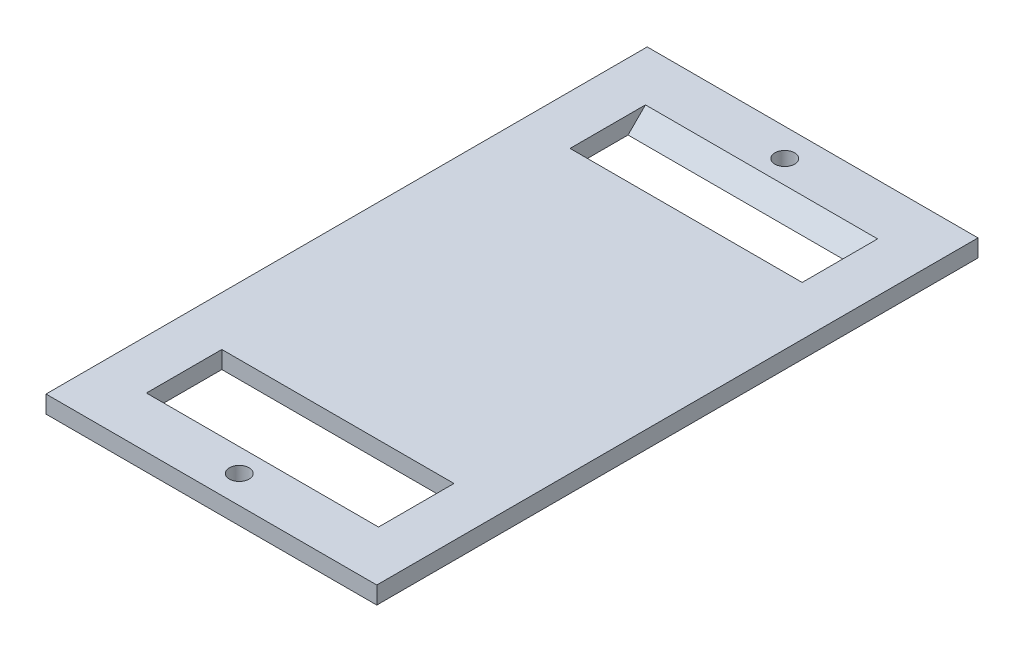
from build123d import *

# Parameters (mm, degrees)
SKETCH_1_W          = 57
SKETCH_1_H          = 103.6
SKETCH_1_R          = 1.7
EXTRUDE_1_DEPTH     = 3
SKETCH_2_W          = 40
SKETCH_2_H          = 10
CUT_EXTRUDE_1_DEPTH = 3
CHAMFER_1_SIZE      = 3


with BuildPart() as part:
    # 草图1 → 凸台-拉伸1 (new body)
    with BuildSketch(Plane(origin=(0, 0, 0), x_dir=(1, 0, 0), z_dir=(0, 1, 0))):
        Rectangle(SKETCH_1_W, SKETCH_1_H)
        with Locations(Location((0, 47, 0), (0, 0, 270))):
            Circle(SKETCH_1_R, mode=Mode.SUBTRACT)
        with Locations(Location((0, -47, 0), (0, 0, 270))):
            Circle(SKETCH_1_R, mode=Mode.SUBTRACT)
    extrude(amount=EXTRUDE_1_DEPTH)

    # 草图2 → 切除-拉伸1 (cut)
    with BuildSketch(Plane(origin=(0, 3, 0), x_dir=(1, 0, 0), z_dir=(0, 1, 0))):
        with Locations((0, 35)):
            Rectangle(SKETCH_2_W, SKETCH_2_H)
        with Locations((0, -35)):
            Rectangle(SKETCH_2_W, SKETCH_2_H)
    extrude(amount=-CUT_EXTRUDE_1_DEPTH, mode=Mode.SUBTRACT)

    # 倒角1
    chamfer_1_edges = [part.edges().sort_by_distance(p)[0] for p in [
        (0, 3, 40),
        (0, 3, -40),
    ]]
    chamfer(chamfer_1_edges, length=CHAMFER_1_SIZE - 0.0001)  # a hair under: the kernel refuses the full size


solid = part.part
